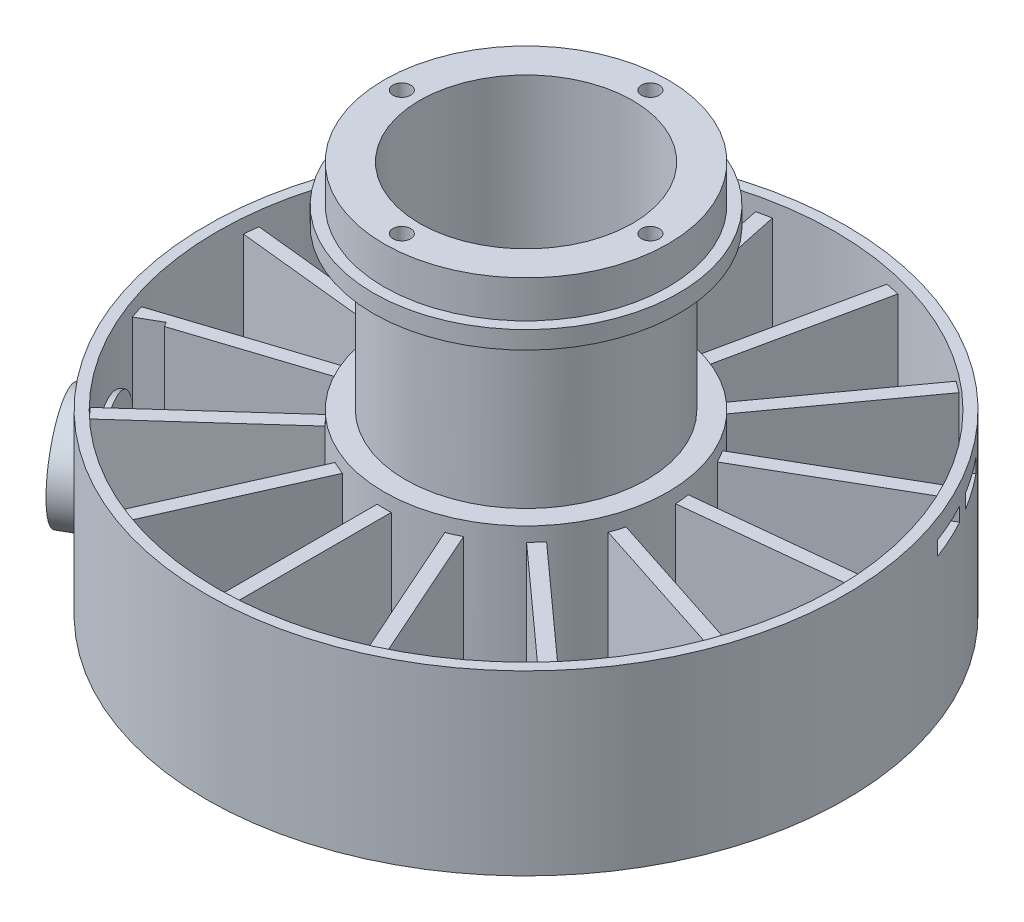
from build123d import *
from build123d.topology import SkipClean

# Parameters (mm, degrees)
SKETCH1_R                = 90
BOSS_EXTRUDE1_DEPTH      = 50
CUT_EXTRUDE1_DEPTH       = 50
SKETCH4_R                = 40
CUT_EXTRUDE2_DEPTH       = 137.546695512
SKETCH5_R                = 40
SKETCH5_R_2              = 34
BOSS_EXTRUDE2_DEPTH      = 50
BOSS_EXTRUDE3_DEPTH      = 50
BOSS_EXTRUDE3_DEPTH_BACK = 15
SKETCH9_R                = 34
SKETCH9_R_2              = 30
SKETCH10_R               = 40
SKETCH10_R_2             = 30
BOSS_EXTRUDE4_DEPTH      = 10.5
SKETCH11_R               = 90
SKETCH11_R_2             = 87
BOSS_EXTRUDE5_DEPTH      = 50
SKETCH12_R               = 87
SKETCH12_R_2             = 40
CUT_EXTRUDE3_DEPTH       = 4
SKETCH13_R               = 87
CUT_EXTRUDE4_DEPTH       = 4
SKETCH15_R               = 43
SKETCH15_R_2             = 34
BOSS_EXTRUDE6_DEPTH      = 5
SKETCH14_R               = 2.5
CUT_EXTRUDE5_DEPTH       = 15
CUT_EXTRUDE6_DEPTH       = 10
CUT_EXTRUDE6_DEPTH_BACK  = 10
SKETCH16_W               = 12.5
SKETCH16_H               = 4
CUT_EXTRUDE7_DEPTH       = 10
CUT_EXTRUDE7_DEPTH_BACK  = 10
SKETCH19_R               = 11
SKETCH20_R               = 14.959162181
SKETCH20_R_2             = 11
BOSS_EXTRUDE7_DEPTH      = 10
CUT_EXTRUDE8_DEPTH       = 144.435420439


with BuildPart() as part:
    # Sketch1 → Boss-Extrude1 (new body)
    with BuildSketch(Plane(origin=(0, 0, 0), x_dir=(1, 0, 0), z_dir=(0, 1, 0))):
        with Locations(Location((0, 0, 0), (0, 0, 270))):
            Circle(SKETCH1_R)
    extrude(amount=BOSS_EXTRUDE1_DEPTH)

    # Sketch2 → Cut-Extrude1 (cut)
    with BuildSketch(Plane.XZ):
        with BuildLine():
            Line((-2, 9.409260219), (-2, 89.977775034))
            ThreePointArc((-2, 89.977775034), (-18.712052174, 88.033284066), (-34.770167253, 83.012260957))
            Line((-34.770167253, 83.012260957), (-2, 9.409260219))
        make_face()
        with BuildLine():
            ThreePointArc((34.770167253, 83.012260957), (18.712052174, 88.033284066), (2, 89.977775034))
            Line((2, 89.977775034), (2, 9.409260219))
            Line((2, 9.409260219), (34.770167253, 83.012260957))
        make_face()
        with BuildLine():
            Line((-5.654181831, 7.782313647), (-38.424349084, 81.385314385))
            ThreePointArc((-38.424349084, 81.385314385), (-52.900672706, 72.811529494), (-65.528256711, 61.693172818))
            Line((-65.528256711, 61.693172818), (-5.654181831, 7.782313647))
        make_face()
        with BuildLine():
            ThreePointArc((65.528256711, 61.693172818), (52.900672706, 72.811529494), (38.424349084, 81.385314385))
            Line((38.424349084, 81.385314385), (5.654181831, 7.782313647))
            Line((5.654181831, 7.782313647), (65.528256711, 61.693172818))
        make_face()
        with BuildLine():
            Line((-8.330704256, 4.809734345), (-68.204779137, 58.720593516))
            ThreePointArc((-68.204779137, 58.720593516), (-77.942286341, 45), (-84.955915279, 29.706774634))
            Line((-84.955915279, 29.706774634), (-8.330704256, 4.809734345))
        make_face()
        with BuildLine():
            ThreePointArc((84.955915279, 29.706774634), (77.942286341, 45), (68.204779137, 58.720593516))
            Line((68.204779137, 58.720593516), (8.330704256, 4.809734345))
            Line((8.330704256, 4.809734345), (84.955915279, 29.706774634))
        make_face()
        with BuildLine():
            Line((-9.566772234, 1.00550828), (-86.191983256, 25.902548569))
            ThreePointArc((-86.191983256, 25.902548569), (-89.506970583, 9.407561694), (-89.693924294, -7.416194762))
            Line((-89.693924294, -7.416194762), (-9.566772234, 1.00550828))
        make_face()
        with BuildLine():
            ThreePointArc((89.693924294, -7.416194762), (89.506970583, 9.407561694), (86.191983256, 25.902548569))
            Line((86.191983256, 25.902548569), (9.566772234, 1.00550828))
            Line((9.566772234, 1.00550828), (89.693924294, -7.416194762))
        make_face()
        with BuildLine():
            Line((-9.14865838, -2.972579302), (-89.275810441, -11.394282343))
            ThreePointArc((-89.275810441, -11.394282343), (-85.595086467, -27.811529494), (-78.923038955, -43.256836709))
            Line((-78.923038955, -43.256836709), (-9.14865838, -2.972579302))
        make_face()
        with BuildLine():
            Line((89.275810441, -11.394282343), (9.14865838, -2.972579302))
            Line((9.14865838, -2.972579302), (78.923038955, -43.256836709))
            ThreePointArc((78.923038955, -43.256836709), (85.595086467, -27.811529494), (89.275810441, -11.394282343))
        make_face()
        with BuildLine():
            Line((-7.14865838, -6.436680917), (-76.923038955, -46.720938324))
            ThreePointArc((-76.923038955, -46.720938324), (-66.883034293, -60.221754572), (-54.505643188, -71.617978614))
            Line((-54.505643188, -71.617978614), (-7.14865838, -6.436680917))
        make_face()
        with BuildLine():
            Line((76.923038955, -46.720938324), (7.14865838, -6.436680917))
            Line((7.14865838, -6.436680917), (54.505643188, -71.617978614))
            ThreePointArc((54.505643188, -71.617978614), (66.883034293, -60.221754572), (76.923038955, -46.720938324))
        make_face()
        with BuildLine():
            Line((-3.912590403, -8.787821926), (-51.26957521, -73.969119623))
            ThreePointArc((-51.26957521, -73.969119623), (-36.606297877, -82.219091188), (-20.663726545, -87.595721387))
            Line((-20.663726545, -87.595721387), (-3.912590403, -8.787821926))
        make_face()
        with BuildLine():
            Line((51.26957521, -73.969119623), (3.912590403, -8.787821926))
            Line((3.912590403, -8.787821926), (20.663726545, -87.595721387))
            ThreePointArc((20.663726545, -87.595721387), (36.606297877, -82.219091188), (51.26957521, -73.969119623))
        make_face()
        with BuildLine():
            Line((0, -9.619468689), (-16.751136142, -88.42736815))
            ThreePointArc((-16.751136142, -88.42736815), (0, -90), (16.751136142, -88.42736815))
            Line((16.751136142, -88.42736815), (0, -9.619468689))
        make_face()
    extrude(amount=-CUT_EXTRUDE1_DEPTH, mode=Mode.SUBTRACT)

    # Sketch4 → Cut-Extrude2 (cut, through all)
    with BuildSketch(Plane(origin=(0, 50, 0), x_dir=(1, 0, 0), z_dir=(0, 1, 0))):
        Circle(SKETCH4_R)
    extrude(amount=-CUT_EXTRUDE2_DEPTH, mode=Mode.SUBTRACT)


with BuildPart() as cut_extrude2_piece_1:
    # of the separate pieces the step leaves, piece 1, a body of its own (cut_extrude2_pieces)
    add(part.part.solids().sort_by_distance((-84.955915279, 0, 29.706774634))[0])


with BuildPart() as cut_extrude2_piece_2:
    # of the separate pieces the step leaves, piece 2, a body of its own (cut_extrude2_pieces)
    add(part.part.solids().sort_by_distance((-65.528256711, 0, 61.693172818))[0])


with BuildPart() as cut_extrude2_piece_3:
    # of the separate pieces the step leaves, piece 3, a body of its own (cut_extrude2_pieces)
    add(part.part.solids().sort_by_distance((10.262360744, 0, -38.661142662))[0])


with BuildPart() as cut_extrude2_piece_4:
    # of the separate pieces the step leaves, piece 4, a body of its own (cut_extrude2_pieces)
    add(part.part.solids().sort_by_distance((14.422025249, 0, 37.309585735))[0])


with BuildPart() as cut_extrude2_piece_5:
    # of the separate pieces the step leaves, piece 5, a body of its own (cut_extrude2_pieces)
    add(part.part.solids().sort_by_distance((-2, 0, 89.977775034))[0])


with BuildPart() as cut_extrude2_piece_6:
    # of the separate pieces the step leaves, piece 6, a body of its own (cut_extrude2_pieces)
    add(part.part.solids().sort_by_distance((39.940175529, 0, -2.186865046))[0])


with BuildPart() as cut_extrude2_piece_7:
    # of the separate pieces the step leaves, piece 7, a body of its own (cut_extrude2_pieces)
    add(part.part.solids().sort_by_distance((25.100036427, 0, -31.144633107))[0])


with BuildPart() as cut_extrude2_piece_8:
    # of the separate pieces the step leaves, piece 8, a body of its own (cut_extrude2_pieces)
    add(part.part.solids().sort_by_distance((-34.770167253, 0, 83.012260957))[0])


with BuildPart() as cut_extrude2_piece_9:
    # of the separate pieces the step leaves, piece 9, a body of its own (cut_extrude2_pieces)
    add(part.part.solids().sort_by_distance((28.350351313, 0, 28.218036438))[0])


with BuildPart() as cut_extrude2_piece_10:
    # of the separate pieces the step leaves, piece 10, a body of its own (cut_extrude2_pieces)
    add(part.part.solids().sort_by_distance((-20.663726545, 0, -87.595721387))[0])


with BuildPart() as cut_extrude2_piece_11:
    # of the separate pieces the step leaves, piece 11, a body of its own (cut_extrude2_pieces)
    add(part.part.solids().sort_by_distance((-54.505643188, 0, -71.617978614))[0])


with BuildPart() as cut_extrude2_piece_12:
    # of the separate pieces the step leaves, piece 12, a body of its own (cut_extrude2_pieces)
    add(part.part.solids().sort_by_distance((37.37664408, 0, 14.247332289))[0])


with BuildPart() as cut_extrude2_piece_13:
    # of the separate pieces the step leaves, piece 13, a body of its own (cut_extrude2_pieces)
    add(part.part.solids().sort_by_distance((35.597687784, 0, -18.242933548))[0])


with BuildPart() as cut_extrude2_piece_14:
    # of the separate pieces the step leaves, piece 14, a body of its own (cut_extrude2_pieces)
    add(part.part.solids().sort_by_distance((-89.693924294, 0, -7.416194762))[0])


with BuildPart() as cut_extrude2_piece_15:
    # of the separate pieces the step leaves, piece 15, a body of its own (cut_extrude2_pieces)
    add(part.part.solids().sort_by_distance((-78.923038955, 0, -43.256836709))[0])


with BuildPart() as body_16:
    # Sketch5 → Boss-Extrude2 (new body)
    with BuildSketch(Plane(origin=(0, 50, 0), x_dir=(1, 0, 0), z_dir=(0, 1, 0))):
        with Locations(Location((0, 0, 0), (0, 0, 270))):
            Circle(SKETCH5_R)
        with Locations(Location((0, 0, 0), (0, 0, 270))):
            Circle(SKETCH5_R_2, mode=Mode.SUBTRACT)
    extrude(amount=-BOSS_EXTRUDE2_DEPTH)

    # Sketch9 → Boss-Extrude3 (add, two sides: drawn at the far end of the back side and taken through both)
    with BuildSketch(Plane(origin=(0, 50, 0), x_dir=(1, 0, 0), z_dir=(0, 1, 0)).offset(-BOSS_EXTRUDE3_DEPTH_BACK)):
        with Locations(Location((0, 0, 0), (0, 0, 270))):
            Circle(SKETCH9_R)
        with Locations(Location((0, 0, 0), (0, 0, 270))):
            Circle(SKETCH9_R_2, mode=Mode.SUBTRACT)
    extrude(amount=BOSS_EXTRUDE3_DEPTH + BOSS_EXTRUDE3_DEPTH_BACK)

    # Sketch10 → Boss-Extrude4 (add)
    with BuildSketch(Plane(origin=(0, 100, 0), x_dir=(1, 0, 0), z_dir=(0, 1, 0))):
        with Locations(Location((0, 0, 0), (0, 0, 270))):
            Circle(SKETCH10_R)
        with Locations(Location((0, 0, 0), (0, 0, 270))):
            Circle(SKETCH10_R_2, mode=Mode.SUBTRACT)
    extrude(amount=BOSS_EXTRUDE4_DEPTH)


    add(cut_extrude2_piece_3.part)  # Boss-Extrude5 merges Cut-Extrude2 piece 3

    add(cut_extrude2_piece_7.part)  # Boss-Extrude5 merges Cut-Extrude2 piece 7

    add(cut_extrude2_piece_14.part)  # Boss-Extrude5 merges Cut-Extrude2 piece 14

    add(cut_extrude2_piece_15.part)  # Boss-Extrude5 merges Cut-Extrude2 piece 15

    add(cut_extrude2_piece_11.part)  # Boss-Extrude5 merges Cut-Extrude2 piece 11

    add(cut_extrude2_piece_5.part)  # Boss-Extrude5 merges Cut-Extrude2 piece 5

    add(cut_extrude2_piece_1.part)  # Boss-Extrude5 merges Cut-Extrude2 piece 1

    add(cut_extrude2_piece_8.part)  # Boss-Extrude5 merges Cut-Extrude2 piece 8

    add(cut_extrude2_piece_2.part)  # Boss-Extrude5 merges Cut-Extrude2 piece 2

    add(cut_extrude2_piece_13.part)  # Boss-Extrude5 merges Cut-Extrude2 piece 13

    add(cut_extrude2_piece_6.part)  # Boss-Extrude5 merges Cut-Extrude2 piece 6

    add(cut_extrude2_piece_4.part)  # Boss-Extrude5 merges Cut-Extrude2 piece 4

    add(cut_extrude2_piece_12.part)  # Boss-Extrude5 merges Cut-Extrude2 piece 12

    add(cut_extrude2_piece_9.part)  # Boss-Extrude5 merges Cut-Extrude2 piece 9

    add(cut_extrude2_piece_10.part)  # Boss-Extrude5 merges Cut-Extrude2 piece 10
    # Sketch11 → Boss-Extrude5 (add)
    with BuildSketch(Plane.XZ):
        with Locations(Location((0, 0, 0), (0, 0, 90))):
            Circle(SKETCH11_R)
        Circle(SKETCH11_R_2, mode=Mode.SUBTRACT)
    extrude(amount=-BOSS_EXTRUDE5_DEPTH)

    # Sketch12 → Cut-Extrude3 (cut)
    with SkipClean():  # the faces are left unmerged after this step: merging them gives an invalid solid
        with BuildSketch(Plane(origin=(0, 50, 0), x_dir=(1, 0, 0), z_dir=(0, 1, 0))):
            with Locations(Location((0, 0, 0), (0, 0, 100.682739604))):
                Circle(SKETCH12_R)
            with Locations(Location((0, 0, 0), (0, 0, 270))):
                Circle(SKETCH12_R_2, mode=Mode.SUBTRACT)
        extrude(amount=-CUT_EXTRUDE3_DEPTH, mode=Mode.SUBTRACT)
    add(body_16.part.scale(1), mode=Mode.REPLACE)  # the faces are merged on a copy

    # Sketch13 → Cut-Extrude4 (cut)
    with SkipClean():  # the faces are left unmerged after this step: merging them gives an invalid solid
        with BuildSketch(Plane.XZ):
            with Locations(Location((0, 0, 0), (0, 0, 270))):
                Circle(SKETCH13_R)
        extrude(amount=-CUT_EXTRUDE4_DEPTH, mode=Mode.SUBTRACT)

    # Sketch15 → Boss-Extrude6 (add)
    with SkipClean():  # the faces are left unmerged after this step: merging them gives an invalid solid
        with BuildSketch(Plane.XZ.offset(-100)):
            with Locations(Location((0, 0, 0), (0, 0, 270))):
                Circle(SKETCH15_R)
            with Locations(Location((0, 0, 0), (0, 0, 90))):
                Circle(SKETCH15_R_2, mode=Mode.SUBTRACT)
        extrude(amount=BOSS_EXTRUDE6_DEPTH)
    add(body_16.part.scale(1), mode=Mode.REPLACE)  # the faces are merged on a copy

    # Sketch14 → Cut-Extrude5 (cut)
    with SkipClean():  # the faces are left unmerged after this step: merging them gives an invalid solid
        with BuildSketch(Plane(origin=(0, 110.5, 0), x_dir=(1, 0, 0), z_dir=(0, 1, 0))):
            with Locations(Location((-35, 0, 0), (0, 0, 270))):
                Circle(SKETCH14_R)
            with Locations(Location((0, 35, 0), (0, 0, 270))):
                Circle(SKETCH14_R)
            with Locations(Location((35, 0, 0), (0, 0, 270))):
                Circle(SKETCH14_R)
            with Locations(Location((0, -35, 0), (0, 0, 270))):
                Circle(SKETCH14_R)
        extrude(amount=-CUT_EXTRUDE5_DEPTH, mode=Mode.SUBTRACT)

    # Sketch16 → Cut-Extrude6 (cut, two sides: drawn at the far end of the back side and taken through both)
    with SkipClean():  # the faces are left unmerged after this step: merging them gives an invalid solid
        with BuildSketch(Plane(origin=(75.324298868, 0, -43.488504228), x_dir=(0.500000000000001, 0, 0.866025403784438), z_dir=(-0.866025403784438, 0, 0.500000000000001)).offset(-CUT_EXTRUDE6_DEPTH_BACK)):
            with Locations((-8.5, 42.625)):
                Rectangle(SKETCH16_W, SKETCH16_H)
            with Locations((8.5, 42.625)):
                Rectangle(SKETCH16_W, SKETCH16_H)
        extrude(amount=CUT_EXTRUDE6_DEPTH + CUT_EXTRUDE6_DEPTH_BACK, mode=Mode.SUBTRACT)

    # Sketch19 → Cut-Extrude7 (cut, two sides: drawn at the far end of the back side and taken through both)
    with SkipClean():  # the faces are left unmerged after this step: merging them gives an invalid solid
        with BuildSketch(Plane(origin=(-74.038395827, 0, 42.746087761), x_dir=(0.49999999999999983, 0, 0.8660254037844389), z_dir=(-0.8660254037844389, 0, 0.49999999999999983)).offset(-CUT_EXTRUDE7_DEPTH_BACK)):
            with Locations(Location((-2, 20, 0), (0, 0, 180))):
                Circle(SKETCH19_R)
        extrude(amount=CUT_EXTRUDE7_DEPTH + CUT_EXTRUDE7_DEPTH_BACK, mode=Mode.SUBTRACT)

    # Sketch20 → Boss-Extrude7 (add)
    with SkipClean():  # the faces are left unmerged after this step: merging them gives an invalid solid
        with BuildSketch(Plane(origin=(-74.038395827, 0, 42.746087761), x_dir=(0.49999999999999983, 0, 0.8660254037844389), z_dir=(-0.8660254037844389, 0, 0.49999999999999983))):
            with Locations(Location((-2, 20, 0), (0, 0, 180))):
                Circle(SKETCH20_R)
            with Locations((-2, 20)):
                Circle(SKETCH20_R_2, mode=Mode.SUBTRACT)
        extrude(amount=BOSS_EXTRUDE7_DEPTH)

    # Sketch21 → Cut-Extrude8 (cut, through all)
    with SkipClean():  # the faces are left unmerged after this step: merging them gives an invalid solid
        with BuildSketch(Plane(origin=(0, 46, 0), x_dir=(1, 0, 0), z_dir=(0, 1, 0))):
            Polygon((-82.102016671, -28.779486765), (-76.039838845, -25.279486765), (-75.295890879, -26.56804244), align=None)
        extrude(amount=-CUT_EXTRUDE8_DEPTH, mode=Mode.SUBTRACT)


solid = body_16.part
